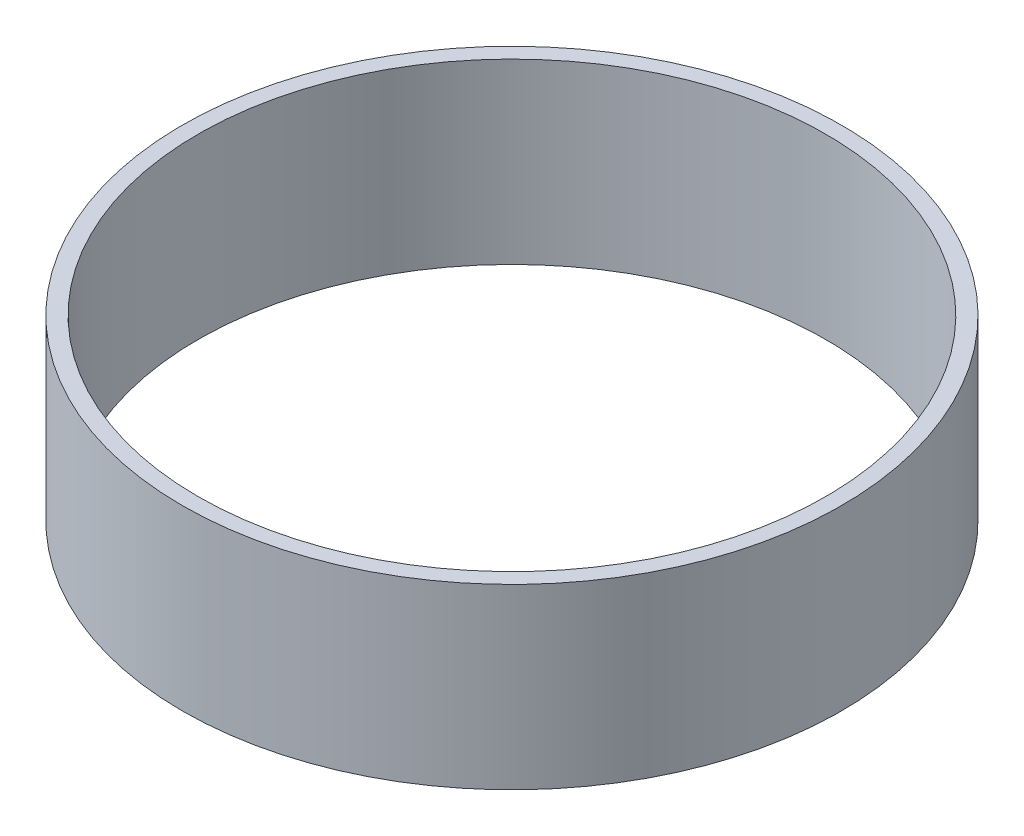
from build123d import *

# Parameters (mm, degrees)
SKETCH_1_R          = 63
EXTRUDE_1_DEPTH     = 34
SKETCH_2_R          = 60
CUT_EXTRUDE_1_DEPTH = 34


with BuildPart() as part:
    # Эскиз1 → Бобышка-Вытянуть1 (new body)
    with BuildSketch(Plane(origin=(0, 0, 0), x_dir=(1, 0, 0), z_dir=(0, 1, 0))):
        Circle(SKETCH_1_R)
    extrude(amount=EXTRUDE_1_DEPTH)

    # Эскиз2 → Вырез-Вытянуть1 (cut)
    with BuildSketch(Plane(origin=(0, 34, 0), x_dir=(1, 0, 0), z_dir=(0, 1, 0))):
        Circle(SKETCH_2_R)
    extrude(amount=-CUT_EXTRUDE_1_DEPTH, mode=Mode.SUBTRACT)


solid = part.part
